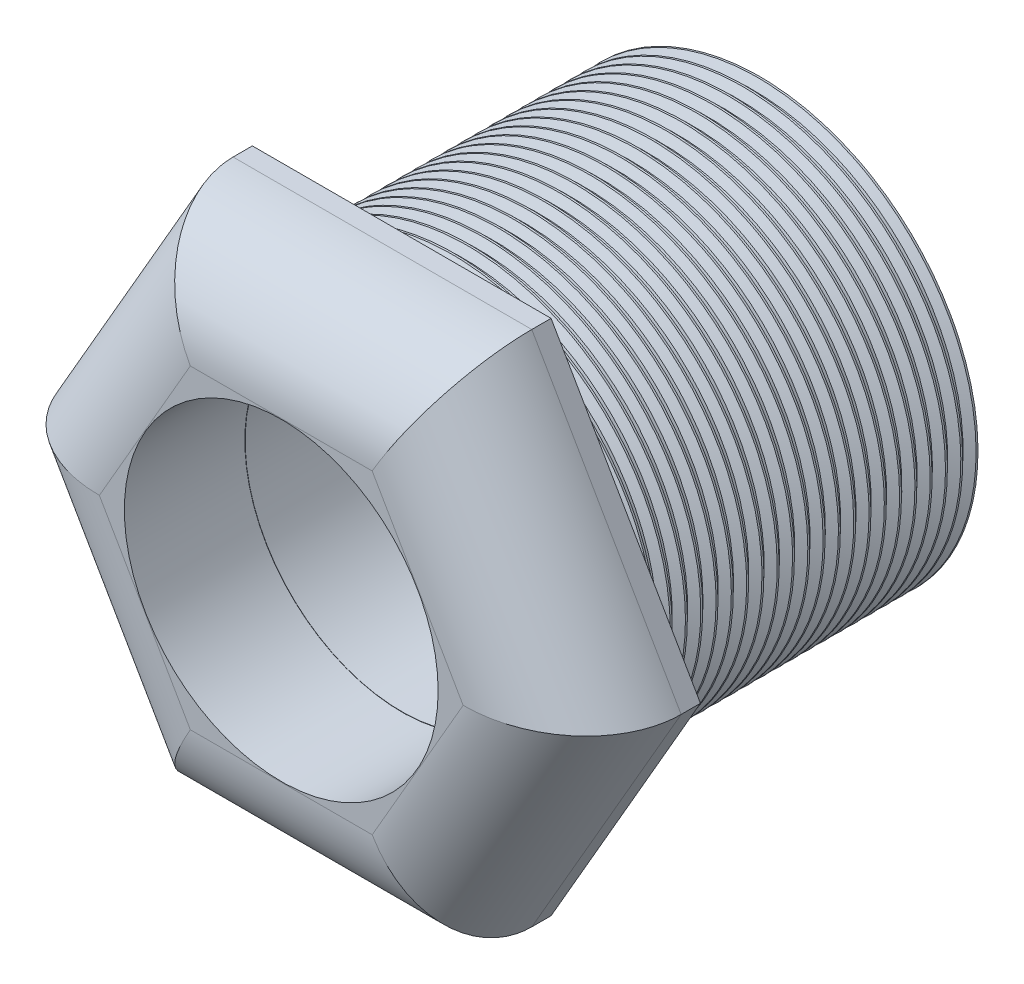
from build123d import *

# Parameters (mm, degrees)
SKETCH1_R           = 4.5
SKETCH1_R_2         = 3.25
BOSS_EXTRUDE1_DEPTH = 7.5
THREAD1_PITCH       = 0.3175
SKETCH4_R           = 6.2
SKETCH4_R_2         = 3.256598131
BOSS_EXTRUDE2_DEPTH = 2.5
CUT_EXTRUDE2_START  = -2.5
CUT_EXTRUDE2_DEPTH  = 2.5
FILLET4_R           = 2.1


with BuildPart() as part:
    # Sketch1 → Boss-Extrude1 (new body)
    with BuildSketch(Plane.XY):
        Circle(SKETCH1_R)
        Circle(SKETCH1_R_2, mode=Mode.SUBTRACT)
    extrude(amount=BOSS_EXTRUDE1_DEPTH)

    # Thread1: the profile of Thread Profile1 profile screwed along a right-hand helix of 23.622047 turns, 6 arcs to a turn; built about Z, then put on its axis
    thread1_z = Axis((0, 0, 0), (0, 0, 1))
    thread1_corners = [(4.5003, 0, -0.000173205), (4.5003, 0, 0.277985704), (4.328148085, 0, 0.17859375), (4.328148085, 0, 0.09921875)]
    with BuildLine(mode=Mode.PRIVATE) as thread1_profile:
        Line(thread1_corners[0], thread1_corners[1])
        Line(thread1_corners[1], thread1_corners[2])
        Line(thread1_corners[2], thread1_corners[3])
        Line(thread1_corners[3], thread1_corners[0])
    thread1_cap = Face(thread1_profile.wire())
    thread1_turn_angles = [0, 30, 60, 90, 120, 150, 180, 210, 240, 270, 300, 330, 360]
    thread1_turn_weights = [1, 0.8660254037844387, 1, 0.8660254037844387, 1, 0.8660254037844387, 1, 0.8660254037844387, 1, 0.8660254037844387, 1, 0.8660254037844387, 1]
    thread1_turn_rails = [Edge.make_bspline([Vector(p[0], p[1], 0).rotate(thread1_z, thread1_turn_angles[k]) / thread1_turn_weights[k] + Vector(0, 0, p[2] + THREAD1_PITCH * thread1_turn_angles[k] / 360) for k in range(13)], [0, 0, 0, 1, 1, 2, 2, 3, 3, 4, 4, 5, 5, 6, 6, 6], 2, thread1_turn_weights) for p in thread1_corners]
    thread1_turn_sides = [Face.make_surface_from_curves(thread1_turn_rails[p[0]], thread1_turn_rails[p[1]]) for p in [(0, 1), (1, 2), (2, 3), (3, 0)]]
    thread1_last_angles = [8280, 8310, 8340, 8370, 8400, 8430, 8460, 8481.968503937, 8503.937007874]
    thread1_last_weights = [1, 0.8660254037844387, 1, 0.8660254037844387, 1, 0.8660254037844387, 1, 0.9273896394584102, 1]
    thread1_last_rails = [Edge.make_bspline([Vector(p[0], p[1], 0).rotate(thread1_z, thread1_last_angles[k]) / thread1_last_weights[k] + Vector(0, 0, p[2] + THREAD1_PITCH * thread1_last_angles[k] / 360) for k in range(9)], [0, 0, 0, 1, 1, 2, 2, 3, 3, 4, 4, 4], 2, thread1_last_weights) for p in thread1_corners]
    thread1_last_sides = [Face.make_surface_from_curves(thread1_last_rails[p[0]], thread1_last_rails[p[1]]) for p in [(0, 1), (1, 2), (2, 3), (3, 0)]]
    thread1 = Plane(origin=(0, 0, 7.5), x_dir=(-1, 0, 0), z_dir=(0, 0, -1)) * Solid(Shell([*[p.moved(Location((0, 0, THREAD1_PITCH * i))) for i in range(23) for p in thread1_turn_sides], *thread1_last_sides, thread1_cap, thread1_cap.rotate(thread1_z, 8503.937007874).moved(Location((0, 0, THREAD1_PITCH * 8503.937007874 / 360)))]))
    add(thread1, mode=Mode.SUBTRACT)

    # Sketch4 → Boss-Extrude2 (add)
    with BuildSketch(Plane.XY.offset(7.5)):
        Circle(SKETCH4_R)
        Circle(SKETCH4_R_2, mode=Mode.SUBTRACT)
    extrude(amount=BOSS_EXTRUDE2_DEPTH)

    # Sketch5 → Cut-Extrude2 (cut)
    with BuildSketch(Plane.XY.offset(10).offset(CUT_EXTRUDE2_START)):
        with BuildLine():
            ThreePointArc((6.2, 0), (5.369357503, 3.1), (3.1, 5.369357503))
            Line((3.1, 5.369357503), (6.2, 0))
        make_face()
        with BuildLine():
            ThreePointArc((3.1, -5.369357503), (5.369357503, -3.1), (6.2, 0))
            Line((6.2, 0), (3.1, -5.369357503))
        make_face()
        with BuildLine():
            Line((3.1, -5.369357503), (-3.1, -5.369357503))
            ThreePointArc((-3.1, -5.369357503), (0, -6.2), (3.1, -5.369357503))
        make_face()
        with BuildLine():
            Line((-3.1, -5.369357503), (-6.2, 0))
            ThreePointArc((-6.2, 0), (-5.369357503, -3.1), (-3.1, -5.369357503))
        make_face()
        with BuildLine():
            Line((-6.2, 0), (-3.1, 5.369357503))
            ThreePointArc((-3.1, 5.369357503), (-5.369357503, 3.1), (-6.2, 0))
        make_face()
        with BuildLine():
            ThreePointArc((3.1, 5.369357503), (0, 6.2), (-3.1, 5.369357503))
            Line((-3.1, 5.369357503), (3.1, 5.369357503))
        make_face()
    extrude(amount=CUT_EXTRUDE2_DEPTH, mode=Mode.SUBTRACT)

    # Fillet4
    fillet4_edges = [part.edges().sort_by_distance(p)[0] for p in [
        (-4.65, 2.684678752, 10),
        (0, -5.369357503, 10),
        (4.65, 2.684678752, 10),
        (4.65, -2.684678752, 10),
        (-4.65, -2.684678752, 10),
        (0, 5.369357503, 10),
    ]]
    fillet(fillet4_edges, radius=FILLET4_R)


solid = part.part
